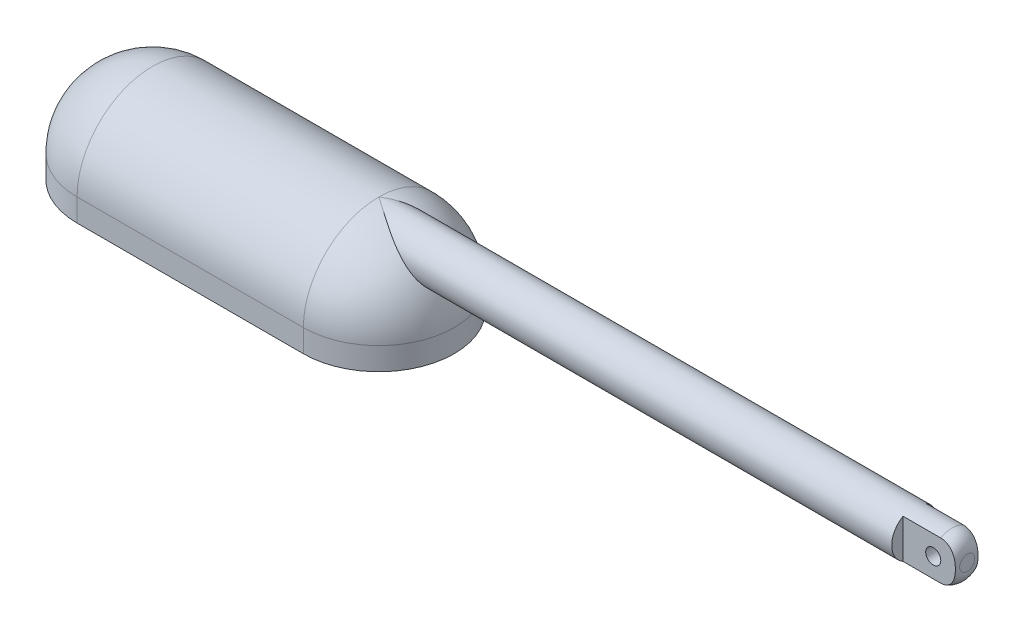
from build123d import *
from build123d.topology import SkipClean

# Parameters (mm, degrees)
REVOLVE2_ANGLE                      = 180
SKETCH1_3_W                         = 354.292858
SKETCH1_3_H                         = 15
REVOLVE3_ANGLE                      = 270
SKETCH1_19_W                        = 354.292858
SKETCH1_19_H                        = 15
BOSS_EXTRUDE1_DEPTH                 = 15
CUT_EXTRUDE1_REACH                  = 492.128
CUT_EXTRUDE1_END_RADIUS             = 15
SKETCH5_R                           = 5
CUT_EXTRUDE1_DIRECTION_2_REACH      = 492.128
CUT_EXTRUDE1_DIRECTION_2_END_RADIUS = 15
CUT_EXTRUDE6_DEPTH                  = 491.127535
CUT_EXTRUDE6_DEPTH_BACK             = 491.127535
SKETCH6_W                           = 35
SKETCH6_H                           = 7.5
FILLET1_R                           = 10


with BuildPart() as part:
    # Sketch1 → Revolve2 (revolve, symmetric)
    with SkipClean():  # the faces are left unmerged after this step: merging them gives an invalid solid
        with BuildSketch(Plane.XY) as revolve2_sk:
            with BuildLine():
                ThreePointArc((145, 0), (141.289076, 18.902948), (130.707142, 35))
                ThreePointArc((130.707142, 35), (114.364917, 46.097722), (95, 50))
                Line((95, 50), (-55, 50))
                ThreePointArc((-55, 50), (-90.355339, 35.355339), (-105, 0))
                Line((-105, 0), (-55, 0))
                ThreePointArc((-55, 0), (-47.67767, 17.67767), (-30, 25))
                Line((-30, 25), (70, 25))
                ThreePointArc((70, 25), (87.67767, 17.67767), (95, 0))
                Line((95, 0), (145, 0))
            make_face()
        revolve(axis=Axis((-55, 0, 0), (1, 0, 0)), revolution_arc=REVOLVE2_ANGLE / 2)
        revolve(revolve2_sk.sketch, axis=Axis((-55, 0, 0), (-1, 0, 0)), revolution_arc=REVOLVE2_ANGLE / 2)

    # Sketch1<3> → Revolve3 (revolve, symmetric)
    with SkipClean():  # the faces are left unmerged after this step: merging them gives an invalid solid
        with BuildSketch(Plane.XY) as revolve3_sk:
            with Locations((307.853571, 42.5)):
                Rectangle(SKETCH1_3_W, SKETCH1_3_H)
            with BuildLine():
                Line((130.707142, 35), (130.707142, 50))
                Line((130.707142, 50), (95, 50))
                ThreePointArc((95, 50), (114.364917, 46.097722), (130.707142, 35))
            make_face()
        revolve(axis=Axis((485, 35, 0), (-1, 0, 0)), revolution_arc=REVOLVE3_ANGLE / 2)
        revolve(revolve3_sk.sketch, axis=Axis((485, 35, 0), (1, 0, 0)), revolution_arc=REVOLVE3_ANGLE / 2)

    # Sketch1<19> → Revolve4 (revolve)
    with SkipClean():  # the faces are left unmerged after this step: merging them gives an invalid solid
        with BuildSketch(Plane.XY, mode=Mode.PRIVATE) as revolve4_sk:
            with Locations((307.853571, 42.5)):
                Rectangle(SKETCH1_19_W, SKETCH1_19_H)
        revolve(revolve4_sk.sketch.rotate(Axis((485, 35, 0), (-1, 0, 0)), 90), axis=Axis((485, 35, 0), (-1, 0, 0)))

    # Sketch2 → Boss-Extrude1 (add)
    with SkipClean():  # the faces are left unmerged after this step: merging them gives an invalid solid
        with BuildSketch(Plane.XZ):
            with BuildLine():
                Line((-55, -50), (95, -50))
                ThreePointArc((95, -50), (145, 0), (95, 50))
                Line((95, 50), (-55, 50))
                ThreePointArc((-55, 50), (-105, 0), (-55, -50))
            make_face()
            with BuildLine():
                ThreePointArc((-30, -25), (-55, 0), (-30, 25))
                Line((-30, 25), (70, 25))
                ThreePointArc((70, 25), (95, 0), (70, -25))
                Line((70, -25), (-30, -25))
            make_face(mode=Mode.SUBTRACT)
        extrude(amount=BOSS_EXTRUDE1_DEPTH)

    # Cut-Extrude1: up to this cylinder (the profile starts inside it)
    with SkipClean():  # the faces are left unmerged after this step: merging them gives an invalid solid
        cut_extrude1_end = Plane(origin=(470, 35, 0), z_dir=(1, 0, 0)) * Cylinder(CUT_EXTRUDE1_END_RADIUS, 1015.256, mode=Mode.PRIVATE)
        # Sketch5 → Cut-Extrude1 (cut, up to the surface)
        with BuildSketch(Plane.XY, mode=Mode.PRIVATE) as cut_extrude1_sk1:
            with Locations(Location((470, 35, 0), (0, 0, 180))):
                Circle(SKETCH5_R)
        cut_extrude1_tool1 = extrude(cut_extrude1_sk1.sketch, amount=-CUT_EXTRUDE1_REACH, mode=Mode.PRIVATE) & cut_extrude1_end
        add(cut_extrude1_tool1.solids().sort_by_distance((470, 35, 0))[0], mode=Mode.SUBTRACT)

    # Cut-Extrude1 direction 2: up to this cylinder (the profile starts inside it)
    with SkipClean():  # the faces are left unmerged after this step: merging them gives an invalid solid
        cut_extrude1_direction_2_end = Plane(origin=(470, 35, 0), z_dir=(1, 0, 0)) * Cylinder(CUT_EXTRUDE1_DIRECTION_2_END_RADIUS, 1015.256, mode=Mode.PRIVATE)
        # Sketch5 → Cut-Extrude1 direction 2 (cut, up to the surface)
        with BuildSketch(Plane.XY, mode=Mode.PRIVATE) as cut_extrude1_direction_2_sk1:
            with Locations(Location((470, 35, 0), (0, 0, 180))):
                Circle(SKETCH5_R)
        cut_extrude1_direction_2_tool1 = extrude(cut_extrude1_direction_2_sk1.sketch, amount=CUT_EXTRUDE1_DIRECTION_2_REACH, mode=Mode.PRIVATE) & cut_extrude1_direction_2_end
        add(cut_extrude1_direction_2_tool1.solids().sort_by_distance((470, 35, 0))[0], mode=Mode.SUBTRACT)

    # Sketch6 → Cut-Extrude6 (cut, two sides: drawn at the far end of the back side and taken through both)
    with SkipClean():  # the faces are left unmerged after this step: merging them gives an invalid solid
        with BuildSketch(Plane(origin=(0, 0, 0), x_dir=(1, 0, 0), z_dir=(0, 1, 0)).offset(-CUT_EXTRUDE6_DEPTH_BACK)):
            with Locations((467.5, 11.25)):
                Rectangle(SKETCH6_W, SKETCH6_H)
            with Locations((467.5, -11.25)):
                Rectangle(SKETCH6_W, SKETCH6_H)
        extrude(amount=CUT_EXTRUDE6_DEPTH + CUT_EXTRUDE6_DEPTH_BACK, mode=Mode.SUBTRACT)

    # Fillet1
    # the kernel refuses this fillet: 10 mm, written as the material it takes off along each edge
    with BuildSketch(Plane(origin=(485, 35, 0), x_dir=(0, 0.5808452103821433, -0.8140140303312491), z_dir=(0, 0.8140140303312491, 0.5808452103821433))) as fillet1_piece_1:
        with BuildLine():
            CenterArc((15 - FILLET1_R, FILLET1_R), FILLET1_R, 270, 90)
            Line((15 - FILLET1_R, 0), (15, 0))
            Line((15, 0), (15, FILLET1_R))
        make_face()
    revolve(axis=Axis((485, 35, 0), (-1, 0, 0)), revolution_arc=251.020024, mode=Mode.SUBTRACT)
    with BuildSketch(Plane(origin=(485, 35, 0), x_dir=(0, -0.5808452103821072, -0.8140140303312748), z_dir=(0, -0.8140140303312748, 0.5808452103821072))) as fillet1_piece_2:
        with BuildLine():
            CenterArc((15 - FILLET1_R, -FILLET1_R), FILLET1_R, 0, 90)
            Line((15 - FILLET1_R, 0), (15, 0))
            Line((15, 0), (15, -FILLET1_R))
        make_face()
    revolve(axis=Axis((485, 35, 0), (1, 0, 0)), revolution_arc=251.020024, mode=Mode.SUBTRACT)


solid = part.part
